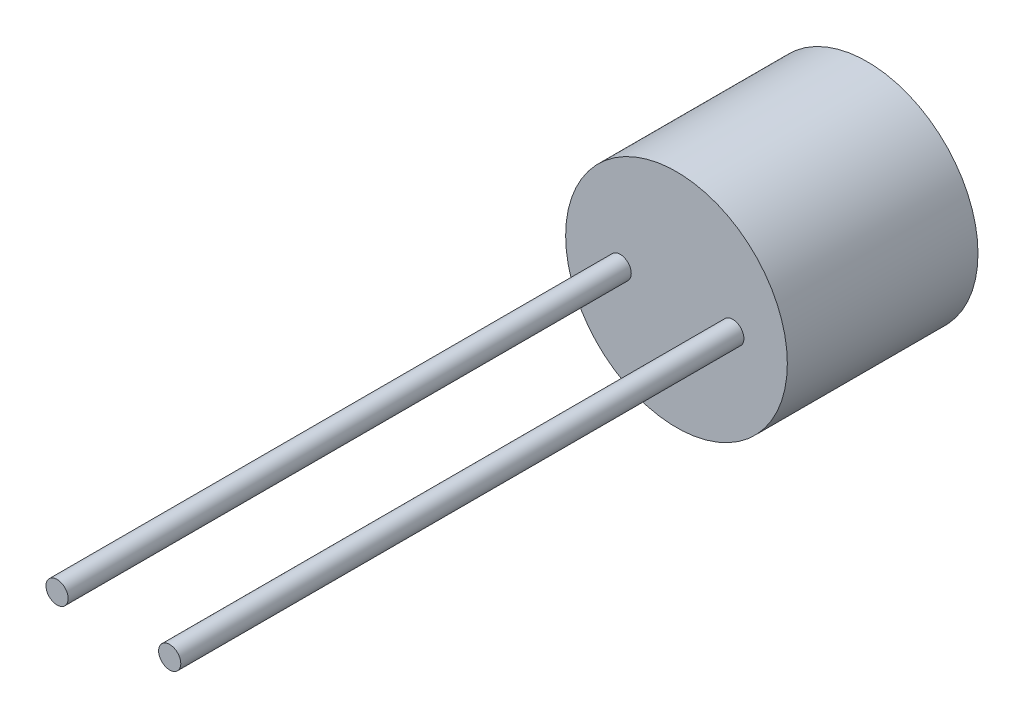
from build123d import *

# Parameters (mm, degrees)
SKETCH_1_R      = 2.5
EXTRUDE_1_DEPTH = 3.3
SKETCH_2_R      = 2.5
EXTRUDE_2_DEPTH = 1
SKETCH_3_R      = 0.25
EXTRUDE_3_DEPTH = 12.7


with BuildPart() as part:
    # 草图1 → 拉伸1 (new body)
    with BuildSketch(Plane.XY):
        Circle(SKETCH_1_R)
    extrude(amount=EXTRUDE_1_DEPTH)

    # 草图2 → 拉伸2 (add)
    with BuildSketch(Plane.XY.offset(3.3)):
        Circle(SKETCH_2_R)
    extrude(amount=EXTRUDE_2_DEPTH)

    # 草图3 → 拉伸3 (add)
    with BuildSketch(Plane.XY.offset(4.3)):
        with Locations((-1.27, 0)):
            Circle(SKETCH_3_R)
        with Locations((1.27, 0)):
            Circle(SKETCH_3_R)
    extrude(amount=EXTRUDE_3_DEPTH)


solid = part.part
